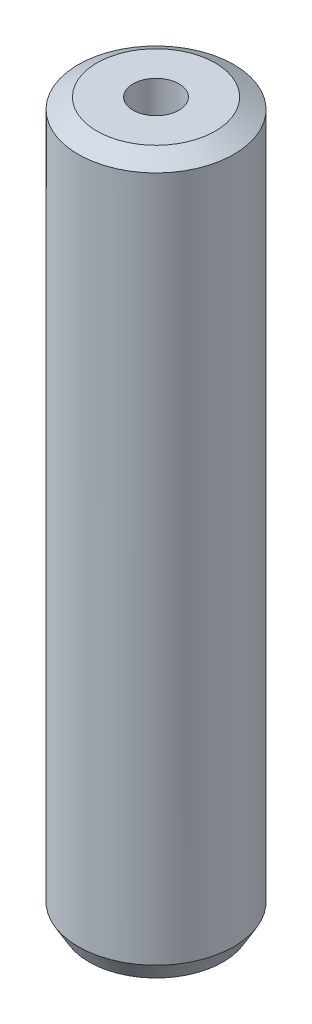
from build123d import *
from OCP.BRepFilletAPI import BRepFilletAPI_MakeChamfer

# Parameters (mm, degrees)
SKETCH1_R           = 35
BOSS_EXTRUDE1_DEPTH = 321.870180489
SKETCH2_R           = 10.312959869
CUT_EXTRUDE1_DEPTH  = 326.653824004
CHAMFER1_SIZE       = 4.847668495
CHAMFER1_SIZE2      = 8.396408132


with BuildPart() as part:
    # Sketch1 → Boss-Extrude1 (new body)
    with BuildSketch(Plane(origin=(0, 0, 0), x_dir=(1, 0, 0), z_dir=(0, 1, 0))):
        Circle(SKETCH1_R)
    extrude(amount=BOSS_EXTRUDE1_DEPTH)

    # Sketch2 → Cut-Extrude1 (cut, through all)
    with BuildSketch(Plane(origin=(0, 0, 0), x_dir=(1, 0, 0), z_dir=(0, 1, 0))):
        Circle(SKETCH2_R)
    extrude(amount=CUT_EXTRUDE1_DEPTH, mode=Mode.SUBTRACT)

    # Chamfer1: one chamfer whose edges measure the first distance from different faces: ONE call of the kernel's chamfer builder (chamfer() names one face for all edges)
    chamfer1_edges_1 = [part.edges().sort_by_distance(p)[0] for p in [
        (-35, 321.870180489, 0),
    ]]
    chamfer1_side_1 = [part.faces().sort_by_distance(p)[0] for p in [
        (-35, 160.935090245, 0),
    ]]
    chamfer1_edges_2 = [part.edges().sort_by_distance(p)[0] for p in [
        (-35, 0, 0),
    ]]
    chamfer1_side_2 = [part.faces().sort_by_distance(p)[0] for p in [
        (-34.010050506, 0, 0),
    ]]
    chamfer1 = BRepFilletAPI_MakeChamfer(part.part.solid().wrapped)
    for e in chamfer1_edges_1:
        chamfer1.Add(CHAMFER1_SIZE, CHAMFER1_SIZE2, e.wrapped, chamfer1_side_1[0].wrapped)  # the first distance lies on this face
    for e in chamfer1_edges_2:
        chamfer1.Add(CHAMFER1_SIZE, CHAMFER1_SIZE2, e.wrapped, chamfer1_side_2[0].wrapped)  # the first distance lies on this face
    add(Compound.cast(chamfer1.Shape()), mode=Mode.REPLACE)


solid = part.part
